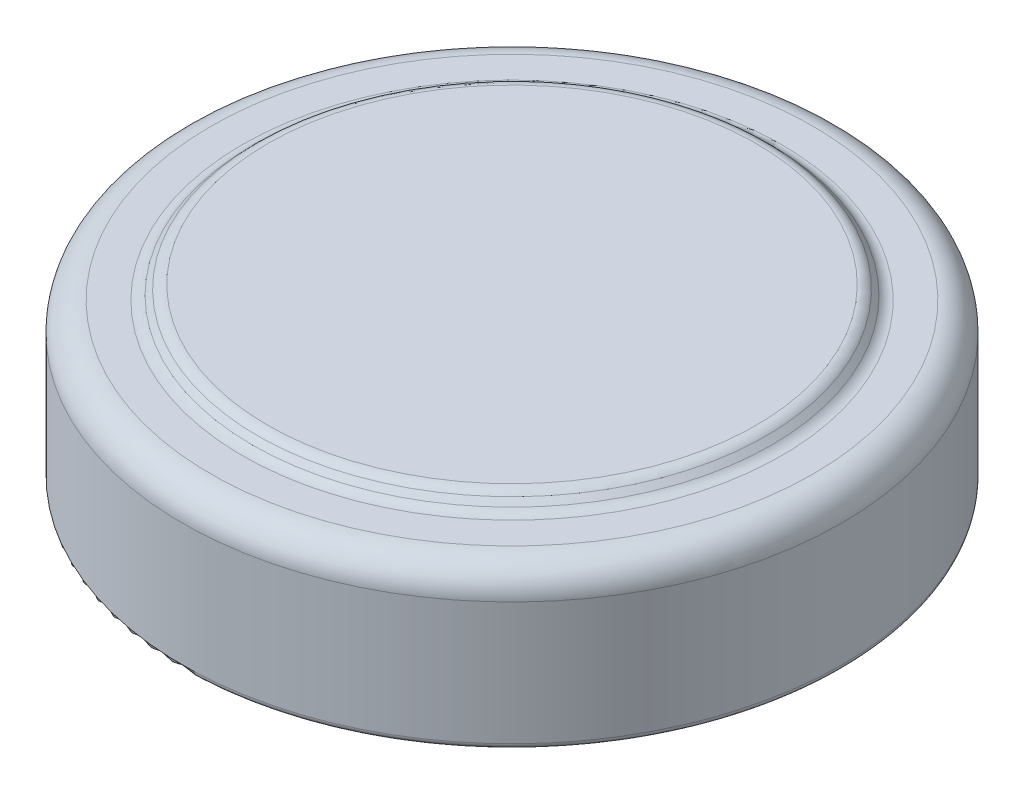
from build123d import *


with BuildPart() as part:
    # Sketch1 → Revolve1 (revolve)
    with BuildSketch(Plane.XY):
        with BuildLine():
            Line((0, 0), (-5.7, 0))
            ThreePointArc((-5.7, 0), (-5.770710678, 0.029289322), (-5.8, 0.1))
            Line((-5.8, 0.1), (-5.8, 2.26))
            ThreePointArc((-5.8, 2.26), (-5.653553391, 2.613553391), (-5.3, 2.76))
            Line((-5.3, 2.76), (-4.743553391, 2.76))
            ThreePointArc((-4.743553391, 2.76), (-4.647882533, 2.779030117), (-4.566776695, 2.833223305))
            Line((-4.566776695, 2.833223305), (-4.473223305, 2.926776695))
            ThreePointArc((-4.473223305, 2.926776695), (-4.392117467, 2.980969883), (-4.296446609, 3))
            Line((-4.296446609, 3), (0, 3))
            Line((0, 3), (0, 0))
        make_face()
    revolve(axis=Axis((0, 3, 0), (0, -1, 0)))


solid = part.part
